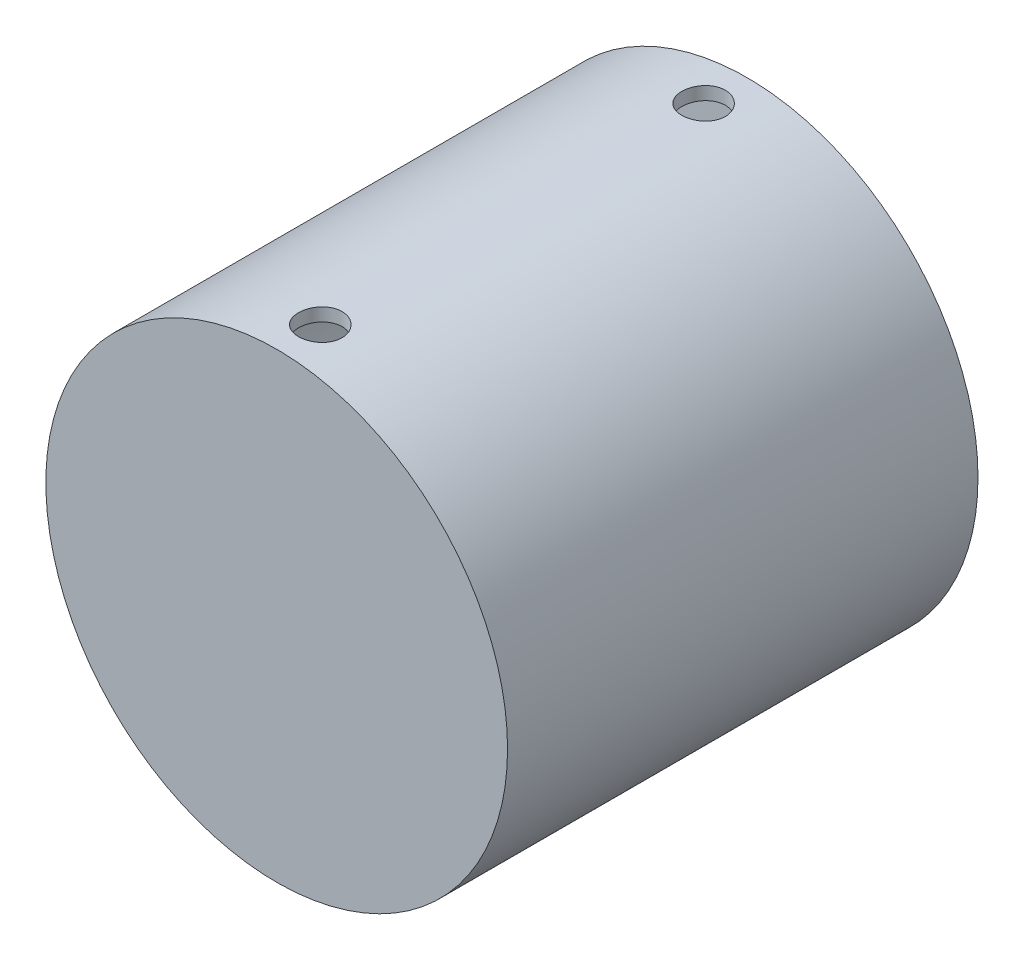
from build123d import *

# Parameters (mm, degrees)
SKETCH5_R           = 53
SKETCH5_R_2         = 50
BOSS_EXTRUDE5_DEPTH = 100
BOSS_EXTRUDE6_START = 4
SKETCH6_R           = 53
BOSS_EXTRUDE6_DEPTH = 4
SKETCH11_R          = 53
BOSS_EXTRUDE9_DEPTH = 4
SKETCH12_R          = 7.5
CUT_EXTRUDE4_DEPTH  = 18
SKETCH13_R          = 5
CUT_EXTRUDE5_DEPTH  = 92


with BuildPart() as part:
    # Sketch5 → Boss-Extrude5 (new body)
    with BuildSketch(Plane.XY):
        Circle(SKETCH5_R)
        Circle(SKETCH5_R_2, mode=Mode.SUBTRACT)
    extrude(amount=-BOSS_EXTRUDE5_DEPTH)

    # Sketch6 → Boss-Extrude6 (add)
    with BuildSketch(Plane.XY.offset(BOSS_EXTRUDE6_START)):
        Circle(SKETCH6_R)
    extrude(amount=-BOSS_EXTRUDE6_DEPTH)

    # Sketch11 → Boss-Extrude9 (add)
    with BuildSketch(Plane(origin=(0, 0, -100), x_dir=(-1, 0, 0), z_dir=(0, 0, -1))):
        Circle(SKETCH11_R)
    extrude(amount=BOSS_EXTRUDE9_DEPTH)

    # Sketch12 → Cut-Extrude4 (cut)
    with BuildSketch(Plane(origin=(0, 0, -100), x_dir=(-1, 0, 0), z_dir=(0, 0, -1))):
        Circle(SKETCH12_R)
    extrude(amount=CUT_EXTRUDE4_DEPTH, mode=Mode.SUBTRACT)

    # Sketch13 → Cut-Extrude5 (cut)
    with BuildSketch(Plane(origin=(0, 0, 0), x_dir=(1, 0, 0), z_dir=(0, 1, 0))):
        with Locations((0, 94)):
            Circle(SKETCH13_R)
        with Locations((0, 6)):
            Circle(SKETCH13_R)
    extrude(amount=CUT_EXTRUDE5_DEPTH, mode=Mode.SUBTRACT)


solid = part.part
